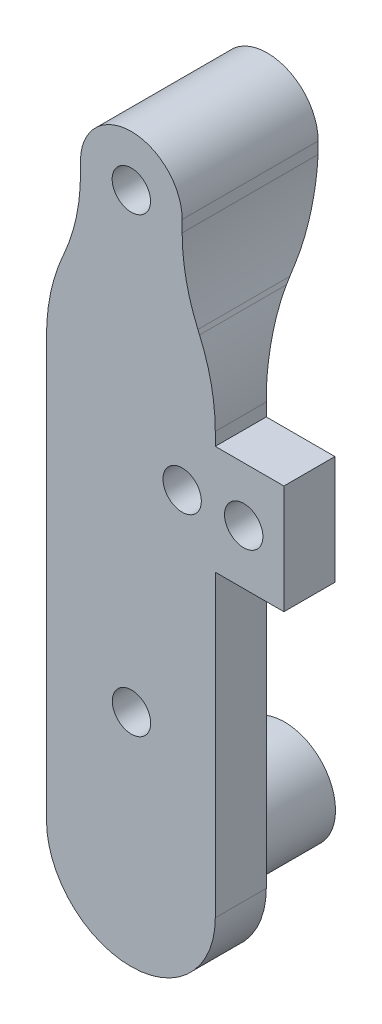
from build123d import *

# Parameters (mm, degrees)
SKETCH1_R           = 1.7907
BOSS_EXTRUDE1_DEPTH = 12.7
CUT_EXTRUDE1_DEPTH  = 43.908371508
SKETCH7_R           = 4.7625
BOSS_EXTRUDE3_DEPTH = 9.525


with BuildPart() as part:
    # Sketch1 → Boss-Extrude1 (new body)
    with BuildSketch(Plane.XY):
        with BuildLine():
            ThreePointArc((-5.89797239, 28.334249775), (-10.644578231, 33.080855616), (-15.391184073, 28.334249775))
            Line((-15.391184073, 28.334249775), (-15.391184073, 27.2867057))
            ThreePointArc((-15.391184073, 27.2867057), (-15.767187067, 23.64949685), (-16.879292984, 20.16612393))
            Line((-16.879292984, 20.16612393), (-17.078075162, 19.711310306))
            ThreePointArc((-17.078075162, 19.711310306), (-18.190181079, 16.227937386), (-18.566184073, 12.590728536))
            Line((-18.566184073, 12.590728536), (-18.566184073, -26.593250225))
            ThreePointArc((-18.566184073, -26.593250225), (-10.68587239, -34.473561908), (-2.805560707, -26.593250225))
            Line((-2.805560707, -26.593250225), (-2.805560707, 1.359449775))
            Line((-2.805560707, 1.359449775), (3.60162761, 1.359449775))
            Line((3.60162761, 1.359449775), (3.60162761, 11.531317118))
            Line((3.60162761, 11.531317118), (-2.805560707, 11.531317118))
            Line((-2.805560707, 11.531317118), (-2.805560707, 12.738028185))
            ThreePointArc((-2.805560707, 12.738028185), (-3.176236758, 16.349653807), (-4.272809259, 19.810689652))
            Line((-4.272809259, 19.810689652), (-4.430723837, 20.174911983))
            ThreePointArc((-4.430723837, 20.174911983), (-5.527296339, 23.635947828), (-5.89797239, 27.24757345))
            Line((-5.89797239, 27.24757345), (-5.89797239, 28.334249775))
        make_face()
        with Locations((-10.644578231, 28.334249775)):
            Circle(SKETCH1_R, mode=Mode.SUBTRACT)
        with Locations((-0.151184073, 6.451317118)):
            Circle(SKETCH1_R, mode=Mode.SUBTRACT)
        with Locations((-10.628684073, -13.868682882)):
            Circle(SKETCH1_R, mode=Mode.SUBTRACT)
        with Locations((-5.89797239, 6.451317118)):
            Circle(SKETCH1_R, mode=Mode.SUBTRACT)
    extrude(amount=BOSS_EXTRUDE1_DEPTH)

    # Sketch5 → Cut-Extrude1 (cut, through all)
    with BuildSketch(Plane.ZY.offset(18.566184073)):
        with BuildLine():
            ThreePointArc((7.9375, 12.916353561), (7.028090228, 16.803677773), (4.488615022, 19.88416172))
            Line((4.488615022, 19.88416172), (3.448884978, 20.677129167))
            ThreePointArc((3.448884978, 20.677129167), (0.909409772, 23.757613113), (0, 27.644937325))
            Line((0, 27.644937325), (0, -34.473561908))
            Line((0, -34.473561908), (7.9375, -34.473561908))
            Line((7.9375, -34.473561908), (7.9375, 12.916353561))
        make_face()
    extrude(amount=-CUT_EXTRUDE1_DEPTH, mode=Mode.SUBTRACT)

    # Sketch7 → Boss-Extrude3 (add)
    with BuildSketch(Plane(origin=(0, 0, 7.9375), x_dir=(-1, 0, 0), z_dir=(0, 0, -1))):
        with Locations((10.628684073, -26.568682882)):
            Circle(SKETCH7_R)
    extrude(amount=BOSS_EXTRUDE3_DEPTH)


solid = part.part
